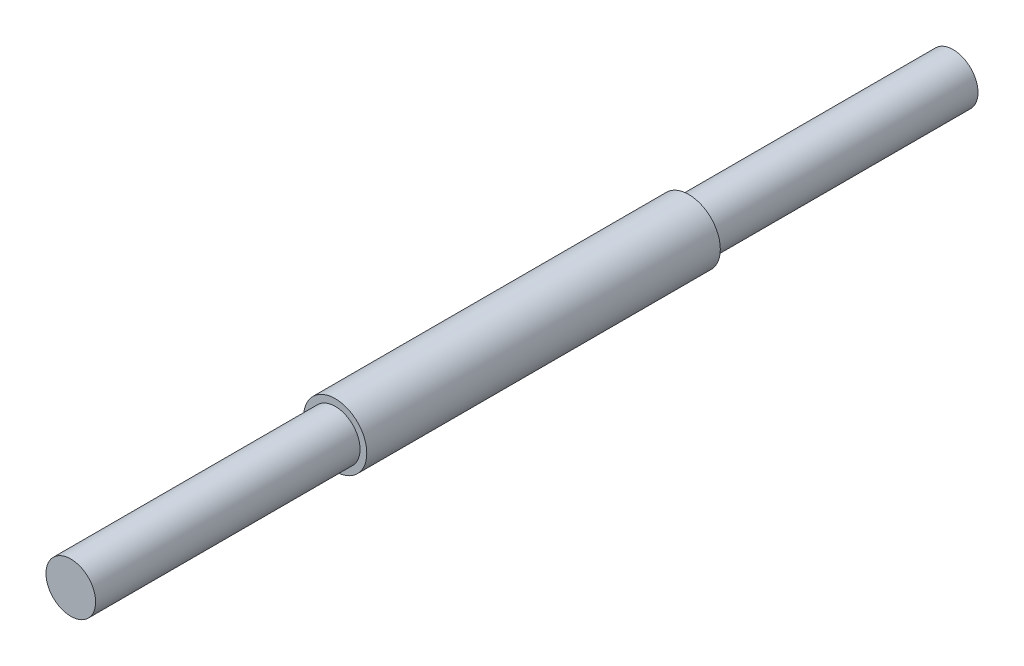
from build123d import *

# Parameters (mm, degrees)
BOSS_EXTRUDE1_DEPTH      = 44.3738
BOSS_EXTRUDE1_DEPTH_BACK = 44.3738
SKETCH2_R                = 2.5
BOSS_EXTRUDE2_DEPTH      = 17.78
BOSS_EXTRUDE2_DEPTH_BACK = 17.78
SKETCH3_R                = 3.175


with BuildPart() as part:
    # Sketch2 → Boss-Extrude1 (new, two sides: drawn at the far end of the back side and taken through both)
    with BuildSketch(Plane.XY.offset(-BOSS_EXTRUDE1_DEPTH_BACK)):
        Circle(SKETCH2_R)
    extrude(amount=BOSS_EXTRUDE1_DEPTH + BOSS_EXTRUDE1_DEPTH_BACK)

    # Sketch3 → Boss-Extrude2 (add, two sides: drawn at the far end of the back side and taken through both)
    with BuildSketch(Plane.XY.offset(-BOSS_EXTRUDE2_DEPTH_BACK)):
        Circle(SKETCH3_R)
    extrude(amount=BOSS_EXTRUDE2_DEPTH + BOSS_EXTRUDE2_DEPTH_BACK)


solid = part.part
